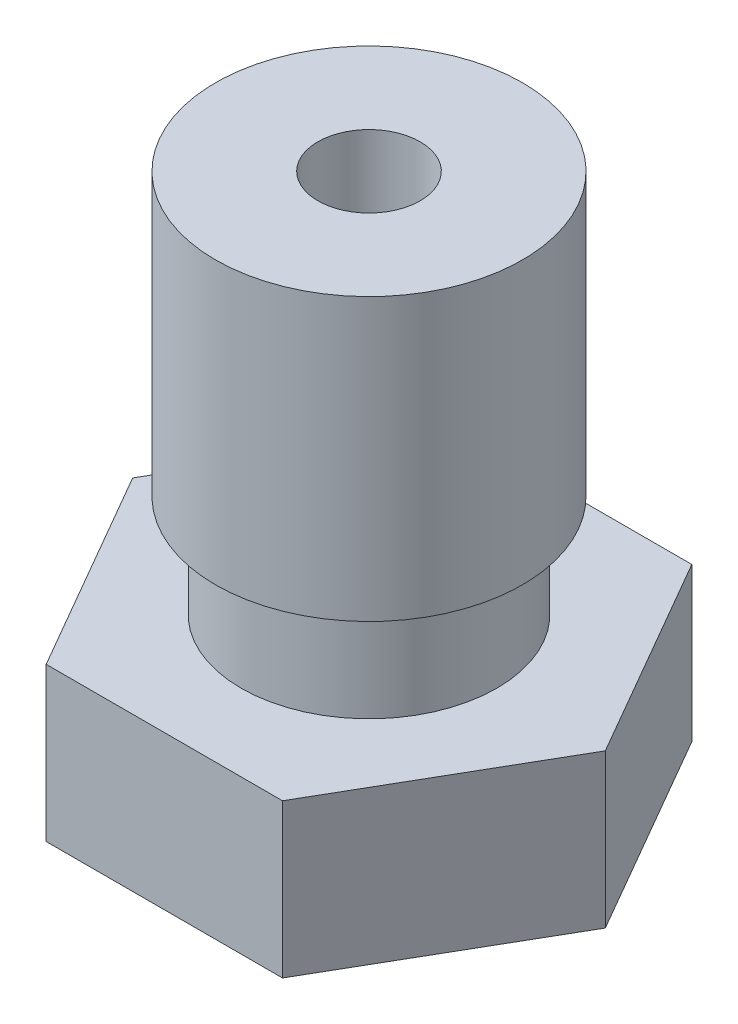
from build123d import *
from build123d.topology import SkipClean

# Parameters (mm, degrees)
SKETCH1_R           = 1
BOSS_EXTRUDE1_DEPTH = 3


with BuildPart() as part:
    # Sketch1 → Boss-Extrude1 (new body)
    with BuildSketch(Plane(origin=(0, 0, 0), x_dir=(1, 0, 0), z_dir=(0, 1, 0))):
        Polygon((2.309401077, 4), (-2.309401077, 4), (-4.618802154, 0), (-2.309401077, -4), (2.309401077, -4), (4.618802154, 0), align=None)
        with Locations(Location((0, 0, 0), (0, 0, 270))):
            Circle(SKETCH1_R, mode=Mode.SUBTRACT)
    extrude(amount=BOSS_EXTRUDE1_DEPTH)

    # Sketch2 → Revolve1 (revolve)
    with SkipClean():  # the faces are left unmerged after this step: merging them gives an invalid solid
        with BuildSketch(Plane.XY, mode=Mode.PRIVATE) as revolve1_sk:
            Polygon((2.5, 3), (1, 3), (1, 10.5), (3, 10.5), (3, 5), (2.5, 5), align=None)
            Polygon((1, 0), (2.000415076, 0), (0.6, -2), (0.225, -2), align=None)
        revolve(revolve1_sk.sketch.rotate(Axis((0, -2, 0), (0, 1, 0)), 90), axis=Axis((0, -2, 0), (0, 1, 0)))
    add(part.part.scale(1), mode=Mode.REPLACE)  # the faces are merged on a copy


solid = part.part
